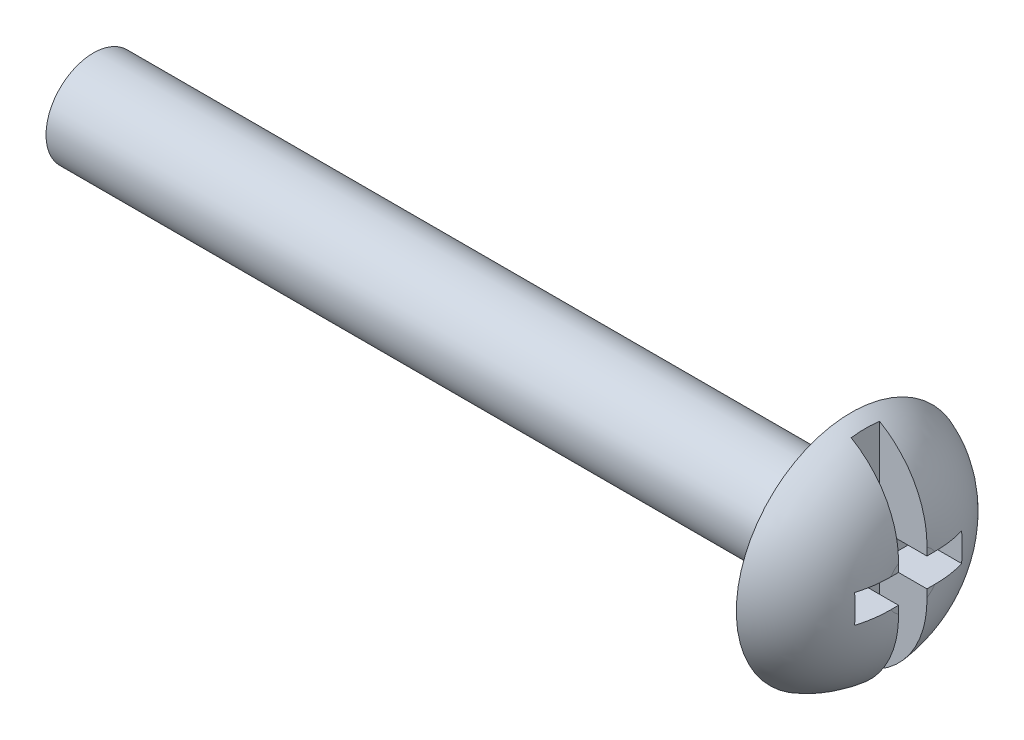
from build123d import *

# Parameters (mm, degrees)
SKETCH1_R           = 4.85
BOSS_EXTRUDE1_DEPTH = 2.6
SKETCH4_R           = 2
BOSS_EXTRUDE3_DEPTH = 32
FILLET1_R           = 4
CUT_EXTRUDE1_DEPTH  = 2


with BuildPart() as part:
    # Sketch1 → Boss-Extrude1 (new body)
    with BuildSketch(Plane(origin=(0, 0, 0), x_dir=(0, 0, -1), z_dir=(1, 0, 0))):
        Circle(SKETCH1_R)
    extrude(amount=BOSS_EXTRUDE1_DEPTH)

    # Sketch4 → Boss-Extrude3 (add)
    with BuildSketch(Plane.ZY):
        Circle(SKETCH4_R)
    extrude(amount=BOSS_EXTRUDE3_DEPTH)

    # Fillet1
    # the kernel refuses this fillet: 4 mm, written as the material it takes off along each edge
    with BuildSketch(Plane(origin=(2.6, 0, 0), x_dir=(0, 0, -1), z_dir=(0, -1, 0))) as fillet1_piece_1:
        with BuildLine():
            CenterArc((1.103001201, -4), FILLET1_R, 20.487315115, 69.512684885)
            Line((1.103001201, 0), (1.103001201, 0.08))
            Line((1.103001201, 0.08), (4.85, 0.08))
            Line((4.85, 0.08), (4.93, 0))
            ThreePointArc((4.93, 0), (4.93, -1.3), (4.924939976, -2.572))
            Line((4.924939976, -2.572), (4.85, -2.6))
        make_face()
    revolve(axis=Axis((2.6, 0, 0), (1, 0, 0)), mode=Mode.SUBTRACT)

    # Sketch5 → Cut-Extrude1 (cut)
    with BuildSketch(Plane(origin=(2.6, 0, 0), x_dir=(0, 0, -1), z_dir=(1, 0, 0))):
        Polygon((-0.6, 0.6), (-2.258943946, 0.6), (-2.258943946, -0.6), (-0.6, -0.6), (-0.6, -5.070709617), (0.6, -5.070709617), (0.6, -0.6), (2.258943946, -0.6), (2.258943946, 0.6), (0.6, 0.6), (0.6, 5.070709617), (-0.6, 5.070709617), align=None)
    extrude(amount=-CUT_EXTRUDE1_DEPTH, mode=Mode.SUBTRACT)


solid = part.part
